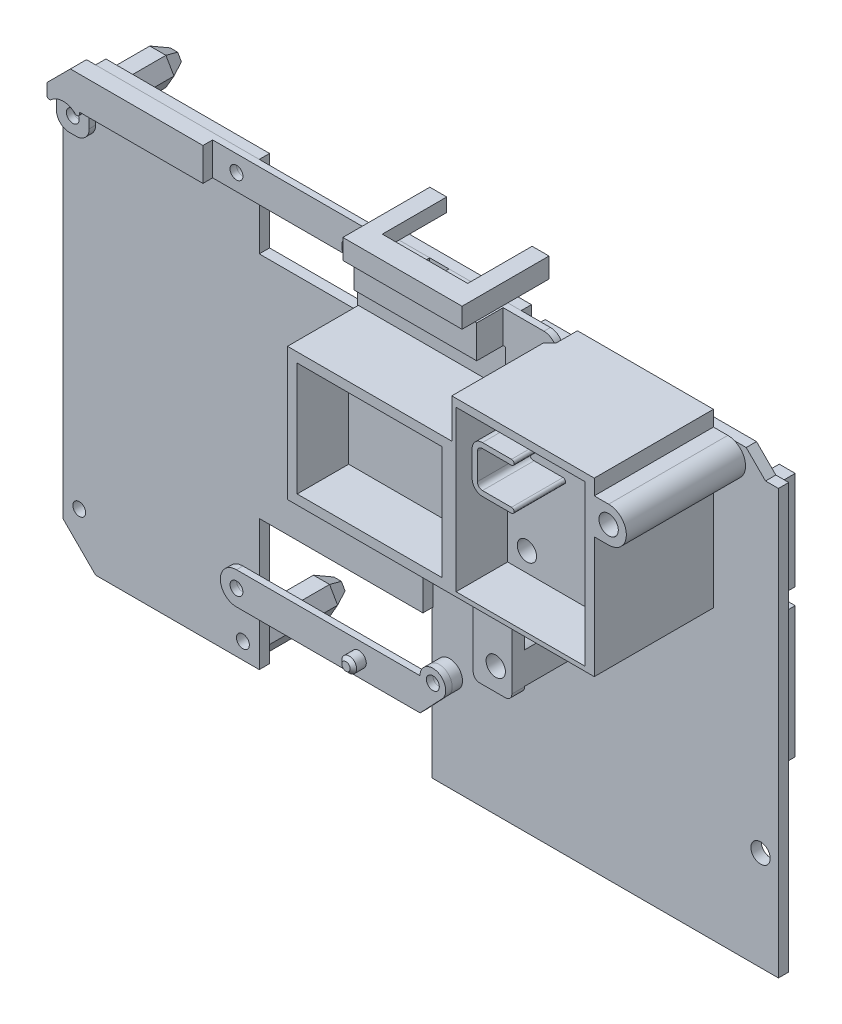
from build123d import *

# Parameters (mm, degrees)
BOSS_EXTRUDE1_DEPTH       = 1.6
SKETCH2_R                 = 1
CUT_EXTRUDE1_DEPTH        = 1.6
SKETCH3_R                 = 1
BOSS_EXTRUDE2_DEPTH       = 13.1
BOSS_EXTRUDE2_2_DEPTH     = 13.1
BOSS_EXTRUDE2_3_DEPTH     = 13.1
BOSS_EXTRUDE4_DEPTH       = 3
CHAMFER4_SIZE             = 2.5
CHAMFER4_SIZE_2           = 1.165769
CHAMFER5_SIZE             = 2.5
CHAMFER5_SIZE_2           = 1.165769
CHAMFER6_SIZE             = 2.5
CHAMFER6_SIZE_2           = 1.165769
SKETCH6_R                 = 1
CUT_EXTRUDE2_DEPTH        = 3
SKETCH7_R                 = 1
BOSS_EXTRUDE5_DEPTH       = 2.5
SKETCH8_W                 = 31.6
SKETCH8_H                 = 5.1
CUT_EXTRUDE3_DEPTH        = 1.5
BOSS_EXTRUDE6_DEPTH       = 3
CHAMFER7_SIZE             = 0.5
FILLET1_R                 = 2
SKETCH9_R                 = 2.722496
CUT_EXTRUDE4_DEPTH        = 1.5
FILLET2_R                 = 0.4
SKETCH10_R                = 2.5
SKETCH10_R_2              = 1
SKETCH10_R_3              = 1.15
SKETCH10_R_4              = 2
BOSS_EXTRUDE7_DEPTH       = 1
SKETCH10_3_R              = 1.15
BOSS_EXTRUDE8_DEPTH       = 3
CHAMFER8_SIZE             = 0.5
SKETCH11_R                = 2
SKETCH11_R_2              = 1
BOSS_EXTRUDE9_DEPTH       = 1.6
SKETCH12_R                = 1
BOSS_EXTRUDE10_DEPTH      = 1
FILLET3_R                 = 2
SKETCH13_W                = 3
SKETCH13_H                = 5.1
CUT_EXTRUDE5_DEPTH        = 0.6
SKETCH14_W                = 1
SKETCH14_H                = 5.1
SKETCH14_W_2              = 1.5
BOSS_EXTRUDE11_DEPTH      = 2.6
SKETCH15_W                = 19.03
SKETCH15_H                = 5.1
BOSS_EXTRUDE12_DEPTH      = 1.5
SKETCH16_R                = 1.5
BOSS_EXTRUDE13_DEPTH      = 1.6
SKETCH17_W                = 2.48
SKETCH17_H                = 15.24
SKETCH17_H_2              = 20.32
SKETCH17_H_3              = 25.4
BOSS_EXTRUDE14_DEPTH      = 2.54
BOSS_EXTRUDE15_DEPTH      = 3.3
SKETCH19_W                = 5.7
SKETCH19_H                = 14.5
SKETCH19_W_2              = 2.7
SKETCH19_H_2              = 11.5
BOSS_EXTRUDE16_DEPTH      = 7.2
SKETCH20_W                = 25.5
SKETCH20_H                = 20.6
SKETCH20_W_2              = 2.7
SKETCH20_H_2              = 11.5
BOSS_EXTRUDE17_DEPTH      = 3
SKETCH21_W                = 5
SKETCH21_H                = 5
BOSS_EXTRUDE18_DEPTH      = 8.9
SKETCH22_W                = 25.5
SKETCH22_H                = 20.6
SKETCH22_W_2              = 22.5
SKETCH22_H_2              = 17.6
BOSS_EXTRUDE19_DEPTH      = 8
BOSS_EXTRUDE20_DEPTH      = 15.2
SKETCH24_W                = 2.7
SKETCH24_H                = 22.2
BOSS_EXTRUDE21_DEPTH      = 7.2
BOSS_EXTRUDE22_DEPTH      = 8
BOSS_EXTRUDE23_DEPTH      = 7.2
SKETCH27_W                = 0.66
SKETCH27_H                = 0.06
BOSS_EXTRUDE24_DEPTH      = 8
BOSS_EXTRUDE25_DEPTH      = 4.2
SKETCH29_W                = 0.66
SKETCH29_H                = 4.55
CUT_EXTRUDE6_DEPTH        = 4.2
BOSS_EXTRUDE26_DEPTH      = 10.5
SKETCH31_W                = 2.150258
SKETCH31_H                = 1.628505
CUT_EXTRUDE7_DEPTH        = 7.5
SKETCH32_W                = 1.34
SKETCH32_H                = 3.86
BOSS_EXTRUDE27_DEPTH      = 3
SKETCH33_R                = 1.5
CUT_EXTRUDE8_DEPTH        = 8
BOSS_EXTRUDE28_DEPTH      = 8
FILLET4_R                 = 0.8
FILLET5_R                 = 1.6
FILLET6_R                 = 0.4
SPLIT2_START              = 9.5
SPLIT2_OUTLINE_W          = 2.7
SPLIT2_OUTLINE_H          = 11.5
SPLIT2_OUTLINE_R          = 1.5
SPLIT2_OUTLINE_H_2        = 22.2
SPLIT2_DEPTH              = 9
SPLIT2_2_DEPTH            = 4
SPLIT2_3_OUTLINE_W        = 2.7
SPLIT2_3_OUTLINE_H        = 11.5
SPLIT2_3_OUTLINE_R        = 1.5
SPLIT2_3_OUTLINE_H_2      = 22.2
SPLIT2_3_DEPTH            = 1
SPLIT2_START_2            = 10.5
SPLIT2_4_OUTLINE_W        = 22.5
SPLIT2_4_OUTLINE_H        = 17.6
SPLIT2_4_OUTLINE_W_2      = 20
SPLIT2_4_OUTLINE_H_2      = 24.8
SPLIT2_4_DEPTH            = 3
SPLIT2_START_3            = 13.5
SPLIT2_5_OUTLINE_W        = 22.5
SPLIT2_5_OUTLINE_H        = 17.6
SPLIT2_5_OUTLINE_W_2      = 20
SPLIT2_5_OUTLINE_H_2      = 24.8
SPLIT2_5_DEPTH            = 5
SKETCH35_W                = 3.7
SKETCH35_H                = 12.5
CUT_EXTRUDE9_DEPTH        = 10
SKETCH36_W                = 3.2
SKETCH36_H                = 22.4
CUT_EXTRUDE10_DEPTH       = 110.007415
BOSS_EXTRUDE29_START      = -18.5
BOSS_EXTRUDE29_OUTLINE_R  = 1.5
BOSS_EXTRUDE29_DEPTH      = 18.5
SPLIT3_START              = 9.5
SPLIT3_OUTLINE_R          = 1.5
SPLIT3_DEPTH              = 9
SPLIT3_2_OUTLINE_R        = 1.5
SPLIT3_2_DEPTH            = 9
SKETCH38_R                = 2
SKETCH38_R_2              = 1
BOSS_EXTRUDE30_DEPTH      = 1.6
CHAMFER9_SIZE             = 1
FILLET7_R                 = 1.6
CUT_EXTRUDE11_DEPTH       = 5.9
CHAMFER10_SIZE            = 1
SKETCH40_R                = 3.5
SKETCH40_R_2              = 1.5
BOSS_EXTRUDE31_DEPTH      = 10.5
BOSS_EXTRUDE31_2_DEPTH    = 10.5
SKETCH41_R                = 3.5
BOSS_EXTRUDE32_DEPTH      = 5
CHAMFER11_SIZE            = 2
BOSS_EXTRUDE33_DEPTH      = 2
SKETCH43_W                = 4.849778
SKETCH43_H                = 18.21798
CUT_EXTRUDE12_DEPTH       = 110.007415
FILLET8_R                 = 1
BOSS_EXTRUDE34_DEPTH      = 2
BOSS_EXTRUDE34_DEPTH_BACK = 1.5
SKETCH44_W                = 18.5
SKETCH44_H                = 3.1
SKETCH45_W                = 2.625
SKETCH45_H                = 3.1
BOSS_EXTRUDE35_DEPTH      = 10
SKETCH46_W                = 15.875
SKETCH46_H                = 1
CUT_EXTRUDE13_DEPTH       = 10


with BuildPart() as part:
    # Sketch1 → Boss-Extrude1 (new body)
    with BuildSketch(Plane.XY):
        Polygon((0, 0), (-25.4, 0), (-30.48, -5.08), (-30.48, -63.5), (-25.4, -68.58), (0, -68.58), (0, -48.26), (25.4, -48.26), (25.4, -25.4), (40.64, -25.4), (40.64, 0), (20.32, 0), (15.24, -5.08), (15.24, -12.7), (0, -12.7), align=None)
    extrude(amount=BOSS_EXTRUDE1_DEPTH)

    # Sketch2 → Cut-Extrude1 (cut)
    with BuildSketch(Plane.XY.offset(1.6)):
        with Locations((-27.94, -7.62)):
            Circle(SKETCH2_R)
        with Locations((-27.94, -60.96)):
            Circle(SKETCH2_R)
        with Locations((-2.54, -66.04)):
            Circle(SKETCH2_R)
    extrude(amount=-CUT_EXTRUDE1_DEPTH, mode=Mode.SUBTRACT)

    # Sketch6 → Cut-Extrude2 (cut)
    with BuildSketch(Plane.XY.offset(1.6)):
        with Locations((-2.54, -2.54)):
            Circle(SKETCH6_R)
        with Locations((-2.54, -58.42)):
            Circle(SKETCH6_R)
        with Locations((22.86, -2.54)):
            Circle(SKETCH6_R)
    extrude(amount=-CUT_EXTRUDE2_DEPTH, mode=Mode.SUBTRACT)


with BuildPart() as body_2:
    # Sketch3 → Boss-Extrude2 (new body)
    with BuildSketch(Plane(origin=(0, 0, 0), x_dir=(-1, 0, 0), z_dir=(0, 0, -1))):
        Polygon((30.44, -7.62), (29.19, -5.454936), (26.69, -5.454936), (25.44, -7.62), (26.69, -9.785064), (29.19, -9.785064), align=None)
        with Locations((27.94, -7.62)):
            Circle(SKETCH3_R, mode=Mode.SUBTRACT)
    extrude(amount=BOSS_EXTRUDE2_DEPTH)



with BuildPart() as body_3:
    # Sketch3 → Boss-Extrude2 2 (new body)
    with BuildSketch(Plane(origin=(0, 0, 0), x_dir=(-1, 0, 0), z_dir=(0, 0, -1))):
        Polygon((30.44, -60.96), (29.19, -58.794936), (26.69, -58.794936), (25.44, -60.96), (26.69, -63.125064), (29.19, -63.125064), align=None)
        with Locations((27.94, -60.96)):
            Circle(SKETCH3_R, mode=Mode.SUBTRACT)
    extrude(amount=BOSS_EXTRUDE2_2_DEPTH)


with BuildPart() as body_4:
    # Sketch3 → Boss-Extrude2 3 (new body)
    with BuildSketch(Plane(origin=(0, 0, 0), x_dir=(-1, 0, 0), z_dir=(0, 0, -1))):
        Polygon((5.04, -66.04), (3.79, -63.874936), (1.29, -63.874936), (0.04, -66.04), (1.29, -68.205064), (3.79, -68.205064), align=None)
        with Locations((2.54, -66.04)):
            Circle(SKETCH3_R, mode=Mode.SUBTRACT)
    extrude(amount=BOSS_EXTRUDE2_3_DEPTH)


with BuildPart() as body_2_1:
    add(body_2.part)

    add(body_3.part)  # Boss-Extrude4 merges body 3

    add(body_4.part)  # Boss-Extrude4 merges body 4
    # Sketch5 → Boss-Extrude4 (add)
    with BuildSketch(Plane(origin=(0, 0, -13.1), x_dir=(-1, 0, 0), z_dir=(0, 0, -1))):
        Polygon((29.19, -9.785064), (30.44, -7.62), (29.19, -5.454936), (26.69, -5.454936), (25.44, -7.62), (26.69, -9.785064), align=None)
        Polygon((3.79, -68.205064), (5.04, -66.04), (3.79, -63.874936), (1.29, -63.874936), (0.04, -66.04), (1.29, -68.205064), align=None)
        Polygon((29.19, -63.125064), (30.44, -60.96), (29.19, -58.794936), (26.69, -58.794936), (25.44, -60.96), (26.69, -63.125064), align=None)
    extrude(amount=-BOSS_EXTRUDE4_DEPTH)

    # Chamfer4
    # the kernel refuses this chamfer: 2.5, 1.165769 mm, written as the material it takes off along each edge
    with BuildSketch(Plane(origin=(-35.667439, -5.454936, -13.1), x_dir=(0, 0, 1), z_dir=(1, 0, 0)), Plane(origin=(-29.928719, 0.15469, -13.1), x_dir=(0, 0, 1), z_dir=(0.49999999999999334, -0.8660254037844425, 0)), Plane(origin=(-22.201281, -2.010374, -13.1), x_dir=(0, 0, 1), z_dir=(-0.5000000000000048, -0.8660254037844359, 0)), Plane(origin=(-20.212561, -9.785064, -13.1), x_dir=(0, 0, 1), z_dir=(-1, 0, 0)), Plane(origin=(-33.678719, -13.229626, -13.1), x_dir=(0, 0, 1), z_dir=(0.5000000000000064, 0.8660254037844349, 0))) as chamfer4_piece_1:
        Polygon((CHAMFER4_SIZE, 0), (0, CHAMFER4_SIZE_2), (0, 0), align=None)
    extrude(amount=15.454877, mode=Mode.SUBTRACT)
    with BuildSketch(Plane(origin=(-25.951281, -15.39469, -13.1), x_dir=(0.8660254037844428, 0.49999999999999284, 0), z_dir=(-0.4999999999999929, 0.8660254037844428, 0))) as chamfer4_piece_2:
        Polygon((CHAMFER4_SIZE_2, 0), (0, -CHAMFER4_SIZE), (0, 0), align=None)
    extrude(amount=15.454877, mode=Mode.SUBTRACT)

    # Chamfer5
    # the kernel refuses this chamfer: 2.5, 1.165769 mm, written as the material it takes off along each edge
    with BuildSketch(Plane(origin=(-10.267439, -63.874936, -13.1), x_dir=(0, 0, 1), z_dir=(1, 0, 0)), Plane(origin=(-4.528719, -58.26531, -13.1), x_dir=(0, 0, 1), z_dir=(0.4999999999999938, -0.8660254037844423, 0)), Plane(origin=(3.198719, -60.430374, -13.1), x_dir=(0, 0, 1), z_dir=(-0.5000000000000053, -0.8660254037844356, 0)), Plane(origin=(5.187439, -68.205064, -13.1), x_dir=(0, 0, 1), z_dir=(-1, 0, 0)), Plane(origin=(-8.278719, -71.649626, -13.1), x_dir=(0, 0, 1), z_dir=(0.500000000000003, 0.866025403784437, 0))) as chamfer5_piece_1:
        Polygon((CHAMFER5_SIZE, 0), (0, CHAMFER5_SIZE_2), (0, 0), align=None)
    extrude(amount=15.454877, mode=Mode.SUBTRACT)
    with BuildSketch(Plane(origin=(-0.551281, -73.81469, -13.1), x_dir=(0.8660254037844397, 0.4999999999999984, 0), z_dir=(-0.49999999999999833, 0.8660254037844397, 0))) as chamfer5_piece_2:
        Polygon((CHAMFER5_SIZE_2, 0), (0, -CHAMFER5_SIZE), (0, 0), align=None)
    extrude(amount=15.454877, mode=Mode.SUBTRACT)

    # Chamfer6
    # the kernel refuses this chamfer: 2.5, 1.165769 mm, written as the material it takes off along each edge
    with BuildSketch(Plane(origin=(-35.667439, -58.794936, -13.1), x_dir=(0, 0, 1), z_dir=(1, 0, 0)), Plane(origin=(-29.928719, -53.18531, -13.1), x_dir=(0, 0, 1), z_dir=(0.49999999999999395, -0.8660254037844423, 0)), Plane(origin=(-22.201281, -55.350374, -13.1), x_dir=(0, 0, 1), z_dir=(-0.5000000000000074, -0.8660254037844345, 0)), Plane(origin=(-20.212561, -63.125064, -13.1), x_dir=(0, 0, 1), z_dir=(-1, 0, 0)), Plane(origin=(-33.678719, -66.569626, -13.1), x_dir=(0, 0, 1), z_dir=(0.5000000000000007, 0.8660254037844383, 0))) as chamfer6_piece_1:
        Polygon((CHAMFER6_SIZE, 0), (0, CHAMFER6_SIZE_2), (0, 0), align=None)
    extrude(amount=15.454877, mode=Mode.SUBTRACT)
    with BuildSketch(Plane(origin=(-25.951281, -68.73469, -13.1), x_dir=(0.8660254037844416, 0.4999999999999948, 0), z_dir=(-0.4999999999999948, 0.8660254037844417, 0))) as chamfer6_piece_2:
        Polygon((CHAMFER6_SIZE_2, 0), (0, -CHAMFER6_SIZE), (0, 0), align=None)
    extrude(amount=15.454877, mode=Mode.SUBTRACT)


with BuildPart() as body_3_2:
    # Sketch7 → Boss-Extrude5 (new body)
    # profile 1 of 8: a face of its own
    with BuildSketch(Plane.XY.offset(1.6)):
        Polygon((0, -5.1), (0, 0), (-25.4, 0), (-30.48, -5.08), (-30.48, -10.1), (-25.4, -10.1), (-25.4, -5.1), align=None)
        with Locations((-27.94, -7.62)):
            Circle(SKETCH7_R, mode=Mode.SUBTRACT)
        with Locations((-2.54, -2.54)):
            Circle(SKETCH7_R, mode=Mode.SUBTRACT)
    # profile 2 of 8: a face of its own
    with BuildSketch(Plane.XY.offset(1.6)):
        Polygon((-30.48, -5.08), (-25.4, 0), (-26.814214, 0), (-30.48, -3.665786), align=None)
    # profile 3 of 8: a face of its own
    with BuildSketch(Plane.XY.offset(1.6)):
        with BuildLine():
            Line((20.32, 0), (0, 0))
            Line((0, 0), (0, -5.1))
            Line((0, -5.1), (15.24, -5.1))
            Line((15.24, -5.1), (15.24, -5.08))
            Line((15.24, -5.08), (16.644974, -3.675026))
            ThreePointArc((16.644974, -3.675026), (15.583867, -1.795091), (17.61, -2.54))
            ThreePointArc((17.61, -2.54), (17.60625, -2.632789), (17.595026, -2.724974))
            Line((17.595026, -2.724974), (20.32, 0))
        make_face()
    # profile 4 of 8: a face of its own
    with BuildSketch(Plane.XY.offset(1.6)):
        with BuildLine():
            Line((25.36, 0), (20.32, 0))
            Line((20.32, 0), (17.595026, -2.724974))
            ThreePointArc((17.595026, -2.724974), (17.273173, -3.353173), (16.644974, -3.675026))
            Line((16.644974, -3.675026), (15.24, -5.08))
            Line((15.24, -5.08), (15.24, -5.1))
            Line((15.24, -5.1), (25.36, -5.1))
            Line((25.36, -5.1), (25.36, 0))
        make_face()
        with Locations((22.86, -2.54)):
            Circle(SKETCH7_R, mode=Mode.SUBTRACT)
    # profile 5 of 8: a face of its own
    with BuildSketch(Plane.XY.offset(1.6)):
        with BuildLine():
            Line((16.644974, -3.675026), (17.595026, -2.724974))
            ThreePointArc((17.595026, -2.724974), (17.60625, -2.632789), (17.61, -2.54))
            ThreePointArc((17.61, -2.54), (15.583867, -1.795091), (16.644974, -3.675026))
        make_face()
    # profile 6 of 8: a face of its own
    with BuildSketch(Plane.XY.offset(1.6)):
        with BuildLine():
            ThreePointArc((16.644974, -3.675026), (17.273173, -3.353173), (17.595026, -2.724974))
            Line((17.595026, -2.724974), (16.644974, -3.675026))
        make_face()
    # profile 7 of 8: a face of its own
    with BuildSketch(Plane.XY.offset(1.6)):
        with BuildLine():
            Line((16.644974, -3.675026), (17.595026, -2.724974))
            ThreePointArc((17.595026, -2.724974), (17.60625, -2.632789), (17.61, -2.54))
            ThreePointArc((17.61, -2.54), (15.583867, -1.795091), (16.644974, -3.675026))
        make_face()
    # profile 8 of 8: a face of its own
    with BuildSketch(Plane.XY.offset(1.6)):
        with BuildLine():
            ThreePointArc((16.644974, -3.675026), (17.273173, -3.353173), (17.595026, -2.724974))
            Line((17.595026, -2.724974), (16.644974, -3.675026))
        make_face()
    extrude(amount=BOSS_EXTRUDE5_DEPTH)

    # Sketch8 → Cut-Extrude3 (cut)
    with BuildSketch(Plane.XY.offset(4.1)):
        with Locations((9.56, -2.55)):
            Rectangle(SKETCH8_W, SKETCH8_H)
    extrude(amount=-CUT_EXTRUDE3_DEPTH, mode=Mode.SUBTRACT)

    # Sketch7<3> → Boss-Extrude6 (add)
    with BuildSketch(Plane.XY.offset(1.6)):
        with BuildLine():
            ThreePointArc((16.644974, -3.675026), (17.273173, -3.353173), (17.595026, -2.724974))
            Line((17.595026, -2.724974), (16.644974, -3.675026))
        make_face()
        with BuildLine():
            Line((16.644974, -3.675026), (17.595026, -2.724974))
            ThreePointArc((17.595026, -2.724974), (17.60625, -2.632789), (17.61, -2.54))
            ThreePointArc((17.61, -2.54), (15.583867, -1.795091), (16.644974, -3.675026))
        make_face()
    extrude(amount=BOSS_EXTRUDE6_DEPTH)

    # Chamfer7
    chamfer7_edges = [body_3_2.edges().sort_by_distance(p)[0] for p in [
        (16.275026, -1.404974, 4.6),
    ]]
    chamfer(chamfer7_edges, length=CHAMFER7_SIZE)

    # Fillet1
    fillet1_edges = [body_3_2.edges().sort_by_distance(p)[0] for p in [
        (-25.4, -10.1, 2.85),
        (-30.48, -10.1, 2.85),
        (25.36, 0, 2.1),
        (25.36, -5.1, 2.1),
    ]]
    fillet(fillet1_edges, radius=FILLET1_R)

    # Sketch9 → Cut-Extrude4 (cut)
    with BuildSketch(Plane.XY.offset(4.1)):
        with Locations((-27.94, -7.62)):
            Circle(SKETCH9_R)
    extrude(amount=-CUT_EXTRUDE4_DEPTH, mode=Mode.SUBTRACT)

    # Fillet2
    fillet2_edges = [body_3_2.edges().sort_by_distance(p)[0] for p in [
        (-30.48, -6.640009, 3.35),
        (-25.4, -6.640009, 3.35),
    ]]
    fillet(fillet2_edges, radius=FILLET2_R)

    # Sketch12 → Boss-Extrude10 (add)
    with BuildSketch(Plane.XY.offset(2.6)):
        with BuildLine():
            Line((23.36, -5.1), (39.18, -5.1))
            Line((39.18, -5.1), (39.18, -9.08))
            Line((39.18, -9.08), (47.18, -9.08))
            Line((47.18, -9.08), (47.18, 0))
            Line((47.18, 0), (23.36, 0))
            ThreePointArc((23.36, 0), (24.774214, -0.585786), (25.36, -2))
            Line((25.36, -2), (25.36, -3.1))
            ThreePointArc((25.36, -3.1), (24.774214, -4.514214), (23.36, -5.1))
        make_face()
        with Locations((43.18, -5.08)):
            Circle(SKETCH12_R, mode=Mode.SUBTRACT)
    extrude(amount=-BOSS_EXTRUDE10_DEPTH)

    # Fillet3
    fillet3_edges = [body_3_2.edges().sort_by_distance(p)[0] for p in [
        (39.18, -9.08, 2.1),
        (47.18, -9.08, 2.1),
        (47.18, 0, 2.1),
    ]]
    fillet(fillet3_edges, radius=FILLET3_R)

    # Sketch13 → Cut-Extrude5 (cut)
    with BuildSketch(Plane(origin=(0, 0, 1.6), x_dir=(-1, 0, 0), z_dir=(0, 0, -1))):
        with Locations((-27.94, -2.55)):
            Rectangle(SKETCH13_W, SKETCH13_H)
    extrude(amount=-CUT_EXTRUDE5_DEPTH, mode=Mode.SUBTRACT)

    # Sketch14 → Boss-Extrude11 (add)
    with BuildSketch(Plane.XY.offset(2.6)):
        with Locations((20.32, -2.55)):
            Rectangle(SKETCH14_W, SKETCH14_H)
        with Locations((38.1, -2.55)):
            Rectangle(SKETCH14_W_2, SKETCH14_H)
    extrude(amount=BOSS_EXTRUDE11_DEPTH)

    # Sketch15 → Boss-Extrude12 (add)
    with BuildSketch(Plane.XY.offset(5.2)):
        with Locations((29.335, -2.55)):
            Rectangle(SKETCH15_W, SKETCH15_H)
    extrude(amount=BOSS_EXTRUDE12_DEPTH)


with BuildPart() as body_4_2:
    # Sketch10 → Boss-Extrude7 (new body)
    # profile 1 of 5: a face of its own
    with BuildSketch(Plane.XY.offset(1.6)):
        with Locations((-2.54, -58.42)):
            Circle(SKETCH10_R)
        with Locations((-2.54, -58.42)):
            Circle(SKETCH10_R_2, mode=Mode.SUBTRACT)
    # profile 2 of 5: a face of its own
    with BuildSketch(Plane.XY.offset(1.6)):
        with BuildLine():
            Line((25.94, -55.92), (0, -55.92))
            Line((0, -55.92), (0, -60.92))
            Line((0, -60.92), (22.180721, -60.92))
            Line((22.180721, -60.92), (25.96, -60.92))
            Line((25.96, -60.92), (29.392274, -57.2951))
            ThreePointArc((29.392274, -57.2951), (27.199915, -57.77803), (25.94, -55.92))
        make_face()
        with Locations((16.46, -58.42)):
            Circle(SKETCH10_R_3, mode=Mode.SUBTRACT)
    # profile 3 of 5: a face of its own
    with BuildSketch(Plane.XY.offset(1.6)):
        with Locations((27.94, -55.92)):
            Circle(SKETCH10_R_4)
        with Locations((27.94, -55.92)):
            Circle(SKETCH10_R_2, mode=Mode.SUBTRACT)
    # profile 4 of 5: a face of its own
    with BuildSketch(Plane.XY.offset(1.6)):
        with Locations((16.46, -58.42)):
            Circle(SKETCH10_R_3)
    # profile 5 of 5: a face of its own
    with BuildSketch(Plane.XY.offset(1.6)):
        with BuildLine():
            Line((0, -55.92), (-2.54, -55.92))
            ThreePointArc((-2.54, -55.92), (-0.772233, -56.652233), (-0.04, -58.42))
            ThreePointArc((-0.04, -58.42), (-0.772233, -60.187767), (-2.54, -60.92))
            Line((-2.54, -60.92), (0, -60.92))
            Line((0, -60.92), (0, -55.92))
        make_face()
    extrude(amount=BOSS_EXTRUDE7_DEPTH)

    # Sketch10<3> → Boss-Extrude8 (add)
    with BuildSketch(Plane.XY.offset(1.6)):
        with Locations(Location((16.46, -58.42, 0), (0, 0, 180))):
            Circle(SKETCH10_3_R)
    extrude(amount=BOSS_EXTRUDE8_DEPTH)

    # Chamfer8
    chamfer8_edges = [body_4_2.edges().sort_by_distance(p)[0] for p in [
        (17.61, -58.42, 4.6),
    ]]
    chamfer(chamfer8_edges, length=CHAMFER8_SIZE)


with BuildPart() as body_5:
    # Sketch11 → Boss-Extrude9 (new body)
    with BuildSketch(Plane(origin=(0, 0, 1.6), x_dir=(-1, 0, 0), z_dir=(0, 0, -1))):
        with Locations((-27.94, -55.92)):
            Circle(SKETCH11_R)
        with Locations((-27.94, -55.92)):
            Circle(SKETCH11_R_2, mode=Mode.SUBTRACT)
    extrude(amount=BOSS_EXTRUDE9_DEPTH)


with BuildPart() as body_6:
    # Sketch16 → Boss-Extrude13 (new body)
    with BuildSketch(Plane(origin=(0, 0, 0), x_dir=(-1, 0, 0), z_dir=(0, 0, -1))):
        Polygon((-25.17, -5.54), (-25.17, -71.34), (-78.97, -71.34), (-78.97, -5.54), (-76.97, -5.54), (-73.97, -2.54), (-41.17, -2.54), (-38.17, -5.54), align=None)
        with Locations((-43.18, -5.08)):
            Circle(SKETCH16_R, mode=Mode.SUBTRACT)
        with Locations((-71.12, -5.08)):
            Circle(SKETCH16_R, mode=Mode.SUBTRACT)
        with Locations((-76.2, -55.92)):
            Circle(SKETCH16_R, mode=Mode.SUBTRACT)
        with Locations((-27.94, -55.92)):
            Circle(SKETCH16_R, mode=Mode.SUBTRACT)
    extrude(amount=BOSS_EXTRUDE13_DEPTH)

    # Sketch17 → Boss-Extrude14 (add)
    with BuildSketch(Plane(origin=(0, 0, -1.6), x_dir=(-1, 0, 0), z_dir=(0, 0, -1))):
        with Locations((-76.2, -13.97)):
            Rectangle(SKETCH17_W, SKETCH17_H)
        with Locations((-76.2, -34.29)):
            Rectangle(SKETCH17_W, SKETCH17_H_2)
        with Locations((-27.94, -40.87)):
            Rectangle(SKETCH17_W, SKETCH17_H_3)
        with Locations((-27.94, -16.51)):
            Rectangle(SKETCH17_W, SKETCH17_H_2)
    extrude(amount=BOSS_EXTRUDE14_DEPTH)


with BuildPart() as body_7:
    # Sketch18 → Boss-Extrude15 (new body)
    with BuildSketch(Plane.XY):
        Polygon((64.69, -24.64), (64.69, -2.54), (47.78, -2.54), (47.78, -7.08), (47.78, -22.08), (48.78, -22.08), (48.78, -26.14), (68.89, -26.14), (68.89, -2.54), (67.39, -2.54), (67.39, -24.64), align=None)
        Polygon((64.69, -2.54), (64.69, -2.44), (67.39, -2.44), (67.39, -2.54), (68.89, -2.54), (68.89, 0.06), (47.78, 0.06), (47.78, -2.54), align=None)
        with BuildLine():
            Line((47.78, -22.08), (47.78, -7.08))
            ThreePointArc((47.78, -7.08), (47.018478, -8.918478), (45.18, -9.68))
            Line((45.18, -9.68), (45.18, -22.08))
            Line((45.18, -22.08), (47.78, -22.08))
        make_face()
    extrude(amount=BOSS_EXTRUDE15_DEPTH)

    # Sketch19 → Boss-Extrude16 (add)
    with BuildSketch(Plane.XY.offset(3.3)):
        with Locations((43.18, -16.33)):
            Rectangle(SKETCH19_W, SKETCH19_H)
        with Locations((43.18, -16.33)):
            Rectangle(SKETCH19_W_2, SKETCH19_H_2, mode=Mode.SUBTRACT)
    extrude(amount=BOSS_EXTRUDE16_DEPTH)

    # Sketch20 → Boss-Extrude17 (add)
    with BuildSketch(Plane.XY.offset(10.5)):
        with Locations((34.03, -16.33)):
            Rectangle(SKETCH20_W, SKETCH20_H)
        with Locations((43.18, -16.33)):
            Rectangle(SKETCH20_W_2, SKETCH20_H_2, mode=Mode.SUBTRACT)
    extrude(amount=-BOSS_EXTRUDE17_DEPTH)

    # Sketch21 → Boss-Extrude18 (add)
    with BuildSketch(Plane.XY.offset(10.5)):
        with Locations((23.78, -19.13)):
            Rectangle(SKETCH21_W, SKETCH21_H)
    extrude(amount=-BOSS_EXTRUDE18_DEPTH)

    # Sketch22 → Boss-Extrude19 (add)
    with BuildSketch(Plane.XY.offset(10.5)):
        with Locations((34.03, -16.33)):
            Rectangle(SKETCH22_W, SKETCH22_H)
        with Locations((34.03, -16.33)):
            Rectangle(SKETCH22_W_2, SKETCH22_H_2, mode=Mode.SUBTRACT)
    extrude(amount=BOSS_EXTRUDE19_DEPTH)

    # Sketch23 → Boss-Extrude20 (add)
    with BuildSketch(Plane.XY.offset(3.3)):
        Polygon((47.44, -26.63), (47.44, -25.94), (47.44, -22.08), (46.78, -22.08), (46.78, -26.63), align=None)
        with BuildLine():
            Line((46.78, -22.08), (47.44, -22.08))
            Line((47.44, -22.08), (47.44, -8.365457))
            ThreePointArc((47.44, -8.365457), (47.147434, -8.779765), (46.78, -9.12939))
            Line((46.78, -9.12939), (46.78, -22.08))
        make_face()
        with BuildLine():
            ThreePointArc((46.78, -9.12939), (47.147434, -8.779765), (47.44, -8.365457))
            Line((47.44, -8.365457), (47.44, -1.14))
            Line((47.44, -1.14), (47.44, 0))
            Line((47.44, 0), (46.78, 0))
            Line((46.78, 0), (46.78, -6.03))
            Line((46.78, -6.03), (46.78, -9.12939))
        make_face()
    extrude(amount=BOSS_EXTRUDE20_DEPTH)

    # Sketch24 → Boss-Extrude21 (add)
    with BuildSketch(Plane.XY.offset(3.3)):
        with BuildLine():
            Line((47.44, -8.365457), (47.44, -22.08))
            Line((47.44, -22.08), (48.78, -22.08))
            Line((48.78, -22.08), (48.78, -26.14))
            Line((48.78, -26.14), (68.89, -26.14))
            Line((68.89, -26.14), (68.89, 0.06))
            Line((68.89, 0.06), (47.78, 0.06))
            Line((47.78, 0.06), (47.78, -7.08))
            ThreePointArc((47.78, -7.08), (47.693563, -7.744831), (47.44, -8.365457))
        make_face()
        with Locations((66.04, -13.54)):
            Rectangle(SKETCH24_W, SKETCH24_H, mode=Mode.SUBTRACT)
    extrude(amount=BOSS_EXTRUDE21_DEPTH)

    # Sketch25 → Boss-Extrude22 (add)
    with BuildSketch(Plane.XY.offset(10.5)):
        Polygon((47.44, -25.94), (67.44, -25.94), (67.44, -1.14), (47.44, -1.14), (47.44, 0.06), (47.78, 0.06), (68.89, 0.06), (68.89, -26.14), (68.89, -26.63), (47.44, -26.63), align=None)
    extrude(amount=BOSS_EXTRUDE22_DEPTH)

    # Sketch26 → Boss-Extrude23 (add)
    with BuildSketch(Plane(origin=(0, 0, 3.3), x_dir=(-1, 0, 0), z_dir=(0, 0, -1))):
        with BuildLine():
            Line((-47.44, 0), (-47.44, -8.365457))
            ThreePointArc((-47.44, -8.365457), (-47.147434, -8.779765), (-46.78, -9.12939))
            Line((-46.78, -9.12939), (-46.78, 0))
            Line((-46.78, 0), (-47.44, 0))
        make_face()
        with BuildLine():
            Line((-47.44, 0.06), (-47.78, 0.06))
            Line((-47.78, 0.06), (-47.78, -7.08))
            ThreePointArc((-47.78, -7.08), (-47.693563, -7.744831), (-47.44, -8.365457))
            Line((-47.44, -8.365457), (-47.44, 0))
            Line((-47.44, 0), (-46.78, 0))
            Line((-46.78, 0), (-46.78, 0.06))
            Line((-46.78, 0.06), (-47.44, 0.06))
        make_face()
    extrude(amount=-BOSS_EXTRUDE23_DEPTH)

    # Sketch27 → Boss-Extrude24 (add)
    with BuildSketch(Plane.XY.offset(10.5)):
        with Locations((47.11, 0.03)):
            Rectangle(SKETCH27_W, SKETCH27_H)
    extrude(amount=BOSS_EXTRUDE24_DEPTH)

    # Sketch28 → Boss-Extrude25 (add)
    with BuildSketch(Plane(origin=(0, 0, 7.5), x_dir=(-1, 0, 0), z_dir=(0, 0, -1))):
        with BuildLine():
            Line((-46.78, -9.12939), (-46.78, -22.08))
            Line((-46.78, -22.08), (-46.03, -22.08))
            Line((-46.03, -22.08), (-46.03, -9.537132))
            ThreePointArc((-46.03, -9.537132), (-46.421849, -9.364253), (-46.78, -9.12939))
        make_face()
    extrude(amount=BOSS_EXTRUDE25_DEPTH)

    # Sketch29 → Cut-Extrude6 (cut)
    with BuildSketch(Plane(origin=(0, 0, 3.3), x_dir=(-1, 0, 0), z_dir=(0, 0, -1))):
        with Locations((-47.11, -24.355)):
            Rectangle(SKETCH29_W, SKETCH29_H)
    extrude(amount=-CUT_EXTRUDE6_DEPTH, mode=Mode.SUBTRACT)

    # Sketch30 → Boss-Extrude26 (add)
    with BuildSketch(Plane(origin=(0, 0, 0), x_dir=(-1, 0, 0), z_dir=(0, 0, -1))):
        Polygon((-47.44, -25.94), (-48.78, -25.94), (-48.78, -26.14), (-68.89, -26.14), (-68.89, -26.63), (-47.44, -26.63), align=None)
    extrude(amount=-BOSS_EXTRUDE26_DEPTH)

    # Sketch31 → Cut-Extrude7 (cut)
    with BuildSketch(Plane(origin=(0, 0, 0), x_dir=(-1, 0, 0), z_dir=(0, 0, -1))):
        with Locations((-47.704871, -26.754252)):
            Rectangle(SKETCH31_W, SKETCH31_H)
    extrude(amount=-CUT_EXTRUDE7_DEPTH, mode=Mode.SUBTRACT)

    # Sketch32 → Boss-Extrude27 (add)
    with BuildSketch(Plane(origin=(0, 0, 7.5), x_dir=(-1, 0, 0), z_dir=(0, 0, -1))):
        with Locations((-48.11, -24.01)):
            Rectangle(SKETCH32_W, SKETCH32_H)
    extrude(amount=-BOSS_EXTRUDE27_DEPTH)

    # Sketch33 → Cut-Extrude8 (cut)
    with BuildSketch(Plane.XY.offset(10.5)):
        with Locations((50.44, -22.94)):
            Circle(SKETCH33_R)
    extrude(amount=-CUT_EXTRUDE8_DEPTH, mode=Mode.SUBTRACT)

    # Sketch34 → Boss-Extrude28 (add)
    with BuildSketch(Plane.XY.offset(10.5)):
        Polygon((56.44, -3.84), (49.94, -3.84), (49.94, -11.09), (56.44, -11.09), (56.44, -10.29), (50.74, -10.29), (50.74, -4.64), (56.44, -4.64), align=None)
    extrude(amount=BOSS_EXTRUDE28_DEPTH)

    # Fillet4
    fillet4_edges = [body_7.edges().sort_by_distance(p)[0] for p in [
        (50.74, -10.29, 14.5),
        (50.74, -4.64, 14.5),
    ]]
    fillet(fillet4_edges, radius=FILLET4_R)

    # Fillet5
    fillet5_edges = [body_7.edges().sort_by_distance(p)[0] for p in [
        (49.94, -3.84, 14.5),
        (49.94, -11.09, 14.5),
    ]]
    fillet(fillet5_edges, radius=FILLET5_R)

    # Fillet6
    fillet6_edges = [body_7.edges().sort_by_distance(p)[0] for p in [
        (56.44, -11.09, 14.5),
        (56.44, -10.29, 14.5),
        (56.44, -3.84, 14.5),
        (56.44, -4.64, 14.5),
    ]]
    fillet(fillet6_edges, radius=FILLET6_R - 0.0001)  # a hair under: the kernel refuses the full size


with BuildPart() as body_8:
    # Split1: the piece on the far side of the plane
    add(body_7.part)
    split(bisect_by=Plane.XY.offset(9.5), keep=Keep.BOTTOM)


with BuildPart() as body_7_1:
    add(body_7.part)

    # Split1
    split(bisect_by=Plane.XY.offset(9.5), keep=Keep.TOP)

    # Split2: read off the stored shape, not the designer's step
    # Split2 outline → Split2 (cut)
    with BuildSketch(Plane.XY.offset(SPLIT2_START)):
        Polygon((21.28, -26.63), (68.89, -26.63), (68.89, 0.06), (46.78, 0.06), (46.78, -6.03), (21.28, -6.03), align=None)
        with Locations((43.18, -16.33)):
            Rectangle(SPLIT2_OUTLINE_W, SPLIT2_OUTLINE_H, mode=Mode.SUBTRACT)
        with BuildLine():
            Line((51.54, -10.29), (56.04, -10.29))
            ThreePointArc((56.04, -10.29), (56.322843, -10.407157), (56.44, -10.69))
            ThreePointArc((56.44, -10.69), (56.322843, -10.972843), (56.04, -11.09))
            Line((56.04, -11.09), (51.54, -11.09))
            ThreePointArc((51.54, -11.09), (50.408629, -10.621371), (49.94, -9.49))
            Line((49.94, -9.49), (49.94, -5.44))
            ThreePointArc((49.94, -5.44), (50.408629, -4.308629), (51.54, -3.84))
            Line((51.54, -3.84), (56.04, -3.84))
            ThreePointArc((56.04, -3.84), (56.322843, -3.957157), (56.44, -4.24))
            ThreePointArc((56.44, -4.24), (56.322843, -4.522843), (56.04, -4.64))
            Line((56.04, -4.64), (51.54, -4.64))
            ThreePointArc((51.54, -4.64), (50.974315, -4.874315), (50.74, -5.44))
            Line((50.74, -5.44), (50.74, -9.49))
            ThreePointArc((50.74, -9.49), (50.974315, -10.055685), (51.54, -10.29))
        make_face(mode=Mode.SUBTRACT)
        with Locations((50.44, -22.94)):
            Circle(SPLIT2_OUTLINE_R, mode=Mode.SUBTRACT)
        with Locations((66.04, -13.54)):
            Rectangle(SPLIT2_OUTLINE_W, SPLIT2_OUTLINE_H_2, mode=Mode.SUBTRACT)
    extrude(amount=SPLIT2_DEPTH, mode=Mode.SUBTRACT)

    # Split2 2 outline → Split2 2 (cut)
    with BuildSketch(Plane.XY.offset(SPLIT2_START)):
        with BuildLine():
            ThreePointArc((50.74, -5.44), (50.974315, -4.874315), (51.54, -4.64))
            Line((51.54, -4.64), (56.04, -4.64))
            ThreePointArc((56.04, -4.64), (56.322843, -4.522843), (56.44, -4.24))
            ThreePointArc((56.44, -4.24), (56.322843, -3.957157), (56.04, -3.84))
            Line((56.04, -3.84), (51.54, -3.84))
            ThreePointArc((51.54, -3.84), (50.408629, -4.308629), (49.94, -5.44))
            Line((49.94, -5.44), (49.94, -9.49))
            ThreePointArc((49.94, -9.49), (50.408629, -10.621371), (51.54, -11.09))
            Line((51.54, -11.09), (56.04, -11.09))
            ThreePointArc((56.04, -11.09), (56.322843, -10.972843), (56.44, -10.69))
            ThreePointArc((56.44, -10.69), (56.322843, -10.407157), (56.04, -10.29))
            Line((56.04, -10.29), (51.54, -10.29))
            ThreePointArc((51.54, -10.29), (50.974315, -10.055685), (50.74, -9.49))
            Line((50.74, -9.49), (50.74, -5.44))
        make_face()
    extrude(amount=SPLIT2_2_DEPTH, mode=Mode.SUBTRACT)


with BuildPart() as body_9:
    # Split2 3 outline → Split2 3 (new body)
    with BuildSketch(Plane.XY.offset(SPLIT2_START)):
        Polygon((21.28, -6.03), (21.28, -26.63), (68.89, -26.63), (68.89, 0.06), (46.78, 0.06), (46.78, -6.03), align=None)
        with Locations((43.18, -16.33)):
            Rectangle(SPLIT2_3_OUTLINE_W, SPLIT2_3_OUTLINE_H, mode=Mode.SUBTRACT)
        with Locations((50.44, -22.94)):
            Circle(SPLIT2_3_OUTLINE_R, mode=Mode.SUBTRACT)
        with Locations((66.04, -13.54)):
            Rectangle(SPLIT2_3_OUTLINE_W, SPLIT2_3_OUTLINE_H_2, mode=Mode.SUBTRACT)
    extrude(amount=SPLIT2_3_DEPTH)

    # Split2 4 outline → Split2 4 (add)
    # profile 1 of 2: a face of its own
    with BuildSketch(Plane.XY.offset(SPLIT2_START_2)):
        Polygon((21.28, -6.03), (21.28, -26.63), (68.89, -26.63), (68.89, 0.06), (46.78, 0.06), (46.78, -6.03), align=None)
        with Locations((34.03, -16.33)):
            Rectangle(SPLIT2_4_OUTLINE_W, SPLIT2_4_OUTLINE_H, mode=Mode.SUBTRACT)
        with Locations((57.44, -13.54)):
            Rectangle(SPLIT2_4_OUTLINE_W_2, SPLIT2_4_OUTLINE_H_2, mode=Mode.SUBTRACT)
    # profile 2 of 2: a face of its own
    with BuildSketch(Plane.XY.offset(SPLIT2_START_2)):
        with BuildLine():
            Line((51.54, -4.64), (56.04, -4.64))
            ThreePointArc((56.04, -4.64), (56.322843, -4.522843), (56.44, -4.24))
            ThreePointArc((56.44, -4.24), (56.322843, -3.957157), (56.04, -3.84))
            Line((56.04, -3.84), (51.54, -3.84))
            ThreePointArc((51.54, -3.84), (50.408629, -4.308629), (49.94, -5.44))
            Line((49.94, -5.44), (49.94, -9.49))
            ThreePointArc((49.94, -9.49), (50.408629, -10.621371), (51.54, -11.09))
            Line((51.54, -11.09), (56.04, -11.09))
            ThreePointArc((56.04, -11.09), (56.322843, -10.972843), (56.44, -10.69))
            ThreePointArc((56.44, -10.69), (56.322843, -10.407157), (56.04, -10.29))
            Line((56.04, -10.29), (51.54, -10.29))
            ThreePointArc((51.54, -10.29), (50.974315, -10.055685), (50.74, -9.49))
            Line((50.74, -9.49), (50.74, -5.44))
            ThreePointArc((50.74, -5.44), (50.974315, -4.874315), (51.54, -4.64))
        make_face()
    extrude(amount=SPLIT2_4_DEPTH)


with BuildPart() as body_10:
    # Split2 5 outline → Split2 5 (new body)
    with BuildSketch(Plane.XY.offset(SPLIT2_START_3)):
        Polygon((21.28, -6.03), (21.28, -26.63), (68.89, -26.63), (68.89, 0.06), (46.78, 0.06), (46.78, -6.03), align=None)
        with Locations((34.03, -16.33)):
            Rectangle(SPLIT2_5_OUTLINE_W, SPLIT2_5_OUTLINE_H, mode=Mode.SUBTRACT)
        with Locations((57.44, -13.54)):
            Rectangle(SPLIT2_5_OUTLINE_W_2, SPLIT2_5_OUTLINE_H_2, mode=Mode.SUBTRACT)
    extrude(amount=SPLIT2_5_DEPTH)


with BuildPart() as cut_extrude9_tool:
    # Sketch35 → Cut-Extrude9 (new body)
    with BuildSketch(Plane.XY.offset(10.5)):
        with Locations((43.18, -16.33)):
            Rectangle(SKETCH35_W, SKETCH35_H)
    extrude(amount=-CUT_EXTRUDE9_DEPTH)


with BuildPart() as body_8_1:
    add(body_8.part)

    # Cut-Extrude9: cut by cut_extrude9_tool
    add(cut_extrude9_tool.part, mode=Mode.SUBTRACT)


with BuildPart() as body_9_1:
    add(body_9.part)

    # Cut-Extrude9: cut by cut_extrude9_tool
    add(cut_extrude9_tool.part, mode=Mode.SUBTRACT)


with BuildPart() as cut_extrude10_tool:
    # Sketch36 → Cut-Extrude10 (new, through all)
    with BuildSketch(Plane.XY.offset(10.5)):
        with Locations((65.79, -13.64)):
            Rectangle(SKETCH36_W, SKETCH36_H)
    extrude(amount=-CUT_EXTRUDE10_DEPTH)


with BuildPart() as body_8_2:
    add(body_8_1.part)

    # Cut-Extrude10: cut by cut_extrude10_tool
    add(cut_extrude10_tool.part, mode=Mode.SUBTRACT)

    # Boss-Extrude29: read off the stored shape, not the designer's step
    # Boss-Extrude29 outline → Boss-Extrude29 (add)
    with BuildSketch(Plane(origin=(0, 0, 0), x_dir=(-1, 0, 0), z_dir=(0, 0, -1)).offset(BOSS_EXTRUDE29_START)):
        with BuildLine():
            Line((-68.89, -7.83), (-68.89, -2.33))
            Line((-68.89, -2.33), (-71.12, -2.33))
            ThreePointArc((-71.12, -2.33), (-73.87, -5.08), (-71.12, -7.83))
            Line((-71.12, -7.83), (-68.89, -7.83))
        make_face()
        with Locations((-71.12, -5.08)):
            Circle(BOSS_EXTRUDE29_OUTLINE_R, mode=Mode.SUBTRACT)
    extrude(amount=BOSS_EXTRUDE29_DEPTH)

    # Split3: read off the stored shape, not the designer's step
    # Split3 outline → Split3 (cut)
    with BuildSketch(Plane.XY.offset(SPLIT3_START)):
        with BuildLine():
            Line((68.89, -2.33), (68.89, -7.83))
            Line((68.89, -7.83), (71.12, -7.83))
            ThreePointArc((71.12, -7.83), (73.87, -5.08), (71.12, -2.33))
            Line((71.12, -2.33), (68.89, -2.33))
        make_face()
        with Locations((71.12, -5.08)):
            Circle(SPLIT3_OUTLINE_R, mode=Mode.SUBTRACT)
    extrude(amount=SPLIT3_DEPTH, mode=Mode.SUBTRACT)

    # Sketch38 → Boss-Extrude30 (add)
    # profile 1 of 2: a face of its own
    with BuildSketch(Plane(origin=(0, 0, 0), x_dir=(-1, 0, 0), z_dir=(0, 0, -1))):
        with BuildLine():
            Line((-43.18, -3.08), (-47.78, -3.08))
            Line((-47.78, -3.08), (-47.78, -7.08))
            ThreePointArc((-47.78, -7.08), (-47.018478, -8.918478), (-45.18, -9.68))
            Line((-45.18, -9.68), (-41.81593, -6.542639))
            ThreePointArc((-41.81593, -6.542639), (-45.040817, -5.813049), (-43.18, -3.08))
        make_face()
    # profile 2 of 2: a face of its own
    with BuildSketch(Plane(origin=(0, 0, 0), x_dir=(-1, 0, 0), z_dir=(0, 0, -1))):
        with Locations((-43.18, -5.08)):
            Circle(SKETCH38_R)
        with Locations(Location((-43.18, -5.08, 0), (0, 0, 180))):
            Circle(SKETCH38_R_2, mode=Mode.SUBTRACT)
    extrude(amount=-BOSS_EXTRUDE30_DEPTH)

    # Chamfer9
    chamfer9_edges = [body_8_2.edges().sort_by_distance(p)[0] for p in [
        (46.78, -4.534695, 3.3),
    ]]
    chamfer(chamfer9_edges, length=CHAMFER9_SIZE - 0.0001)  # a hair under: the kernel refuses the full size

    # Fillet7
    fillet7_edges = [body_8_2.edges().sort_by_distance(p)[0] for p in [
        (47.78, -3.08, 0.8),
    ]]
    fillet(fillet7_edges, radius=FILLET7_R)

    # Sketch39 → Cut-Extrude11 (cut)
    with BuildSketch(Plane.XY.offset(1.6)):
        with BuildLine():
            Line((44.536643, -9.08), (42.586315, -7.261107))
            ThreePointArc((42.586315, -7.261107), (42.866265, -8.266015), (43.518675, -9.08))
            Line((43.518675, -9.08), (44.536643, -9.08))
        make_face()
        with BuildLine():
            Line((44.536643, -9.08), (43.518675, -9.08))
            ThreePointArc((43.518675, -9.08), (44.296824, -9.525404), (45.18, -9.68))
            Line((45.18, -9.68), (44.536643, -9.08))
        make_face()
        with BuildLine():
            ThreePointArc((45.18, -9.68), (45.610961, -9.644034), (46.03, -9.537132))
            Line((46.03, -9.537132), (46.03, -9.08))
            Line((46.03, -9.08), (44.536643, -9.08))
            Line((44.536643, -9.08), (45.18, -9.68))
        make_face()
    extrude(amount=CUT_EXTRUDE11_DEPTH, mode=Mode.SUBTRACT)

    # Chamfer10
    chamfer10_edges = [body_8_2.edges().sort_by_distance(p)[0] for p in [
        (41.924338, -9.08, 7.5),
        (46.78, -7.579695, 7.5),
        (45.14063, -9.679702, 7.5),
    ]]
    chamfer(chamfer10_edges, length=CHAMFER10_SIZE)


with BuildPart() as body_9_2:
    add(body_9_1.part)

    # Cut-Extrude10: cut by cut_extrude10_tool
    add(cut_extrude10_tool.part, mode=Mode.SUBTRACT)


with BuildPart() as body_11:
    # Split3 2 outline → Split3 2 (new body)
    with BuildSketch(Plane.XY.offset(SPLIT3_START)):
        with BuildLine():
            Line((68.89, -2.33), (68.89, -7.83))
            Line((68.89, -7.83), (71.12, -7.83))
            ThreePointArc((71.12, -7.83), (73.87, -5.08), (71.12, -2.33))
            Line((71.12, -2.33), (68.89, -2.33))
        make_face()
        with Locations((71.12, -5.08)):
            Circle(SPLIT3_2_OUTLINE_R, mode=Mode.SUBTRACT)
    extrude(amount=SPLIT3_2_DEPTH)


with BuildPart() as body_12:
    # Split4: read off the stored shape, not the designer's step
    # Split4: the piece on the far side of the plane
    add(body_11.part)
    split(bisect_by=Plane.XY.offset(13.5), keep=Keep.BOTTOM)


with BuildPart() as body_11_1:
    add(body_11.part)

    # Split4
    split(bisect_by=Plane.XY.offset(13.5), keep=Keep.TOP)


with BuildPart() as body_9_3:
    add(body_9_2.part)

    # Combine1: read off the stored shape, not the designer's step
    # Combine1: union body 12
    add(body_12.part)


with BuildPart() as body_8_3:
    add(body_8_2.part)

    # Combine2: union body 9, body 10, body 7, body 11
    add(body_9_3.part)
    add(body_10.part)
    add(body_7_1.part)
    add(body_11_1.part)


with BuildPart() as body_8_2_1:
    # Sketch40 → Boss-Extrude31 (new body)
    with BuildSketch(Plane.XY):
        with Locations((45.6, -30.86)):
            Circle(SKETCH40_R)
        with Locations((45.6, -30.86)):
            Circle(SKETCH40_R_2, mode=Mode.SUBTRACT)
    extrude(amount=BOSS_EXTRUDE31_DEPTH)

    # Sketch41 → Boss-Extrude32 (add)
    with BuildSketch(Plane(origin=(0, 0, 0), x_dir=(-1, 0, 0), z_dir=(0, 0, -1))):
        with Locations(Location((-45.6, -30.86, 0), (0, 0, 180))):
            Circle(SKETCH41_R)
    extrude(amount=-BOSS_EXTRUDE32_DEPTH)

    # Chamfer11
    chamfer11_edges = [body_8_2_1.edges().sort_by_distance(p)[0] for p in [
        (42.1, -30.86, 0),
    ]]
    chamfer(chamfer11_edges, length=CHAMFER11_SIZE)



with BuildPart() as body_9_2_1:
    # Sketch40 → Boss-Extrude31 2 (new body)
    with BuildSketch(Plane.XY):
        with Locations((45.6, -40.86)):
            Circle(SKETCH40_R)
        with Locations((45.6, -40.86)):
            Circle(SKETCH40_R_2, mode=Mode.SUBTRACT)
    extrude(amount=BOSS_EXTRUDE31_2_DEPTH)


with BuildPart() as body_8_2_2:
    add(body_8_2_1.part)

    add(body_9_2_1.part)  # Boss-Extrude33 merges body 9 2
    # Sketch42 → Boss-Extrude33 (add)
    with BuildSketch(Plane.XY.offset(10.5)):
        with BuildLine():
            Line((48.1, -28.41051), (48.1, -27.36))
            Line((48.1, -27.36), (45.6, -27.36))
            ThreePointArc((45.6, -27.36), (46.955874, -27.633298), (48.1, -28.41051))
        make_face()
        with BuildLine():
            ThreePointArc((42.1, -30.86), (43.125126, -28.385126), (45.6, -27.36))
            Line((45.6, -27.36), (42.1, -27.36))
            Line((42.1, -27.36), (42.1, -30.86))
        make_face()
        with BuildLine():
            ThreePointArc((48.1, -33.30949), (44.277124, -34.10037), (42.1, -30.86))
            Line((42.1, -30.86), (42.1, -40.86))
            ThreePointArc((42.1, -40.86), (44.277124, -37.61963), (48.1, -38.41051))
            Line((48.1, -38.41051), (48.1, -33.30949))
        make_face()
        with BuildLine():
            ThreePointArc((45.6, -44.36), (43.125126, -43.334874), (42.1, -40.86))
            Line((42.1, -40.86), (42.1, -44.36))
            Line((42.1, -44.36), (45.6, -44.36))
        make_face()
        with BuildLine():
            Line((48.1, -44.36), (48.1, -43.30949))
            ThreePointArc((48.1, -43.30949), (46.955874, -44.086702), (45.6, -44.36))
            Line((45.6, -44.36), (48.1, -44.36))
        make_face()
    extrude(amount=-BOSS_EXTRUDE33_DEPTH)

    # Sketch43 → Cut-Extrude12 (cut, through all)
    with BuildSketch(Plane.XY.offset(10.5)):
        with Locations((50.524889, -36.46899)):
            Rectangle(SKETCH43_W, SKETCH43_H)
    extrude(amount=-CUT_EXTRUDE12_DEPTH, mode=Mode.SUBTRACT)

    # Fillet8
    fillet8_edges = [body_8_2_2.edges().sort_by_distance(p)[0] for p in [
        (48.1, -27.36, 9.5),
        (48.1, -44.36, 9.5),
        (42.1, -44.36, 9.5),
        (42.1, -27.36, 9.5),
    ]]
    fillet(fillet8_edges, radius=FILLET8_R)


with BuildPart() as body_9_3_1:
    # Sketch44 → Boss-Extrude34 (new, two sides: drawn at the far end of the back side and taken through both)
    with BuildSketch(Plane.XY.offset(6.7).offset(-BOSS_EXTRUDE34_DEPTH_BACK)):
        with Locations((29.32, 1.55)):
            Rectangle(SKETCH44_W, SKETCH44_H)
    extrude(amount=BOSS_EXTRUDE34_DEPTH + BOSS_EXTRUDE34_DEPTH_BACK)

    # Sketch45 → Boss-Extrude35 (add)
    with BuildSketch(Plane(origin=(0, 0, 5.2), x_dir=(-1, 0, 0), z_dir=(0, 0, -1))):
        with Locations((-37.2575, 1.55)):
            Rectangle(SKETCH45_W, SKETCH45_H)
        with Locations((-21.3825, 1.55)):
            Rectangle(SKETCH45_W, SKETCH45_H)
    extrude(amount=BOSS_EXTRUDE35_DEPTH)

    # Sketch46 → Cut-Extrude13 (cut)
    with BuildSketch(Plane(origin=(0, 0, -4.8), x_dir=(-1, 0, 0), z_dir=(0, 0, -1))):
        with Locations((-29.32, 0.5)):
            Rectangle(SKETCH46_W, SKETCH46_H)
    extrude(amount=-CUT_EXTRUDE13_DEPTH, mode=Mode.SUBTRACT)


solid = Compound([part.part, body_2_1.part, body_3_2.part, body_4_2.part, body_5.part, body_6.part, body_8_3.part, body_8_2_2.part, body_9_3_1.part])
